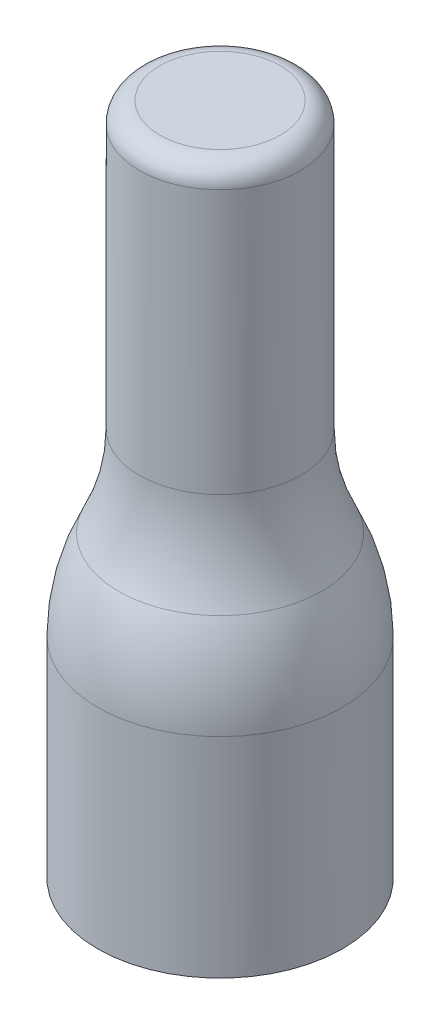
from build123d import *

# Parameters (mm, degrees)
SKETCH1_R           = 6
SKETCH1_R_2         = 4
BOSS_EXTRUDE1_DEPTH = 10
SKETCH2_R           = 6
BOSS_EXTRUDE2_DEPTH = 3
SKETCH3_R           = 3.95
BOSS_EXTRUDE3_DEPTH = 20
FILLET1_R           = 1
FILLET2_R           = 10
FILLET3_R           = 1
FILLET4_R           = 10


with BuildPart() as part:
    # Sketch1 → Boss-Extrude1 (new body)
    with BuildSketch(Plane(origin=(0, 0, 0), x_dir=(1, 0, 0), z_dir=(0, 1, 0))):
        with Locations(Location((0, 0, 0), (0, 0, 270))):
            Circle(SKETCH1_R)
        with Locations(Location((0, 0, 0), (0, 0, 270))):
            Circle(SKETCH1_R_2, mode=Mode.SUBTRACT)
    extrude(amount=BOSS_EXTRUDE1_DEPTH)

    # Sketch2 → Boss-Extrude2 (add)
    with BuildSketch(Plane(origin=(0, 10, 0), x_dir=(1, 0, 0), z_dir=(0, 1, 0))):
        with Locations(Location((0, 0, 0), (0, 0, 270))):
            Circle(SKETCH2_R)
    extrude(amount=BOSS_EXTRUDE2_DEPTH)

    # Sketch3 → Boss-Extrude3 (add)
    with BuildSketch(Plane(origin=(0, 13, 0), x_dir=(1, 0, 0), z_dir=(0, 1, 0))):
        with Locations(Location((0, 0, 0), (0, 0, 270))):
            Circle(SKETCH3_R)
    extrude(amount=BOSS_EXTRUDE3_DEPTH)

    # Fillet1
    fillet1_edges = [part.edges().sort_by_distance(p)[0] for p in [
        (0, 33, -3.95),
    ]]
    fillet(fillet1_edges, radius=FILLET1_R)

    # Fillet2
    # the kernel refuses this fillet: 10 mm, written as the material it adds along each edge
    with BuildSketch(Plane(origin=(0, 13, 0), x_dir=(0, 0, 1), z_dir=(-1, 0, 0))) as fillet2_piece_1:
        with BuildLine():
            CenterArc((13.95, 6.066094295), FILLET2_R, 180, 37.344744354)
            Line((6, 0), (5.841, -0.121321886))
            ThreePointArc((5.841, -0.121321886), (4.975, -0.2), (3.95, -0.2))
            Line((3.95, -0.2), (3.75, 0))
            Line((3.75, 0), (3.75, 6.066094295))
            Line((3.75, 6.066094295), (3.95, 6.066094295))
        make_face()
    revolve(axis=Axis((0, 13, 0), (0, 1, 0)))

    # Fillet3
    fillet3_edges = [part.edges().sort_by_distance(p)[0] for p in [
        (0, 0, -4),
    ]]
    fillet(fillet3_edges, radius=FILLET3_R)

    # Fillet4
    fillet4_edges = [part.edges().sort_by_distance(p)[0] for p in [
        (0, 13, -6),
    ]]
    fillet(fillet4_edges, radius=FILLET4_R)


solid = part.part
